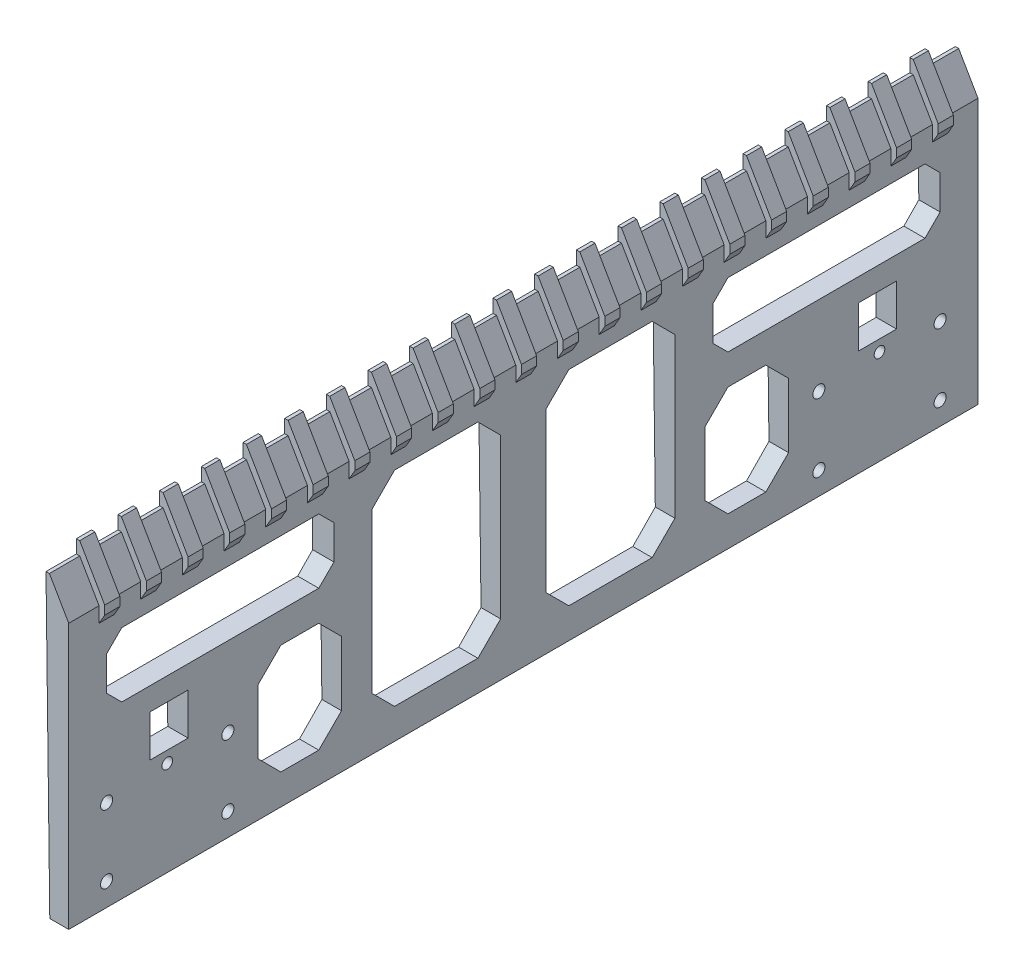
from build123d import *

# Parameters (mm, degrees)
SKETCH_1_W                  = 240
SKETCH_1_H                  = 70
EXTRUDE_1_DEPTH             = 6
CUT_EXTRUDE_2_DEPTH         = 251.071989635
EXTRUDE_2_DEPTH             = 240
EXTRUDE_3_DEPTH             = 2
PATTERN_LINEAR_1_COUNT      = 11
PATTERN_LINEAR_1_PITCH      = 11
PATTERN_LINEAR_1_COUNT_DIR2 = 11
PATTERN_LINEAR_1_PITCH_DIR2 = 11
HOLE_WIZARD_1_D             = 3.2
HOLE_WIZARD_1_CBORE_D       = 6
HOLE_WIZARD_1_CBORE_DEPTH   = 3.4
SKETCH_16_R                 = 1.4
CUT_EXTRUDE_3_DEPTH         = 10
SKETCH_17_W                 = 10
SKETCH_17_H                 = 11
CUT_EXTRUDE_4_DEPTH         = 251.112474699
CUT_EXTRUDE_5_REACH         = 252.112


with BuildPart() as part:
    # 草图1 → 凸台-拉伸1 (new body)
    with BuildSketch(Plane(origin=(0, 0, 0), x_dir=(0, 0, -1), z_dir=(1, 0, 0))):
        with Locations((120, -35)):
            Rectangle(SKETCH_1_W, SKETCH_1_H)
    extrude(amount=EXTRUDE_1_DEPTH)

    # 草图3 → 切除-拉伸2 (cut, through all)
    with BuildSketch(Plane(origin=(6, 0, 0), x_dir=(0, 0, -1), z_dir=(1, 0, 0))):
        Polygon((14, -8), (66, -8), (70, -12), (70, -21), (66, -25), (14, -25), (10, -21), (10, -12), align=None)
        Polygon((80, -14), (86, -8), (108, -8), (114, -14), (114, -56), (108, -62), (86, -62), (80, -56), align=None)
        Polygon((50, -56), (56, -62), (66, -62), (72, -56), (72, -39), (66, -33), (56, -33), (50, -39), align=None)
    cut_extrude_2 = extrude(amount=-CUT_EXTRUDE_2_DEPTH, mode=Mode.SUBTRACT)

    # 草图6 → 凸台-拉伸2 (add)
    with BuildSketch(Plane.XY):
        Polygon((6, 0), (0, 0), (0, 8.833459119), (0.9, 8.833459119), align=None)
    extrude(amount=-EXTRUDE_2_DEPTH)

    # 草图8 → 凸台-拉伸3 (add, symmetric)
    with BuildSketch(Plane.XY.offset(-120)):
        Polygon((0, 10.392304845), (0, 12.333459119), (0.9, 12.333459119), (7.5, 0.901923789), (7.5, -1.401923789), (6, -4), (6, 0), (0.9, 8.833459119), (0, 8.833459119), align=None)
    extrude_3 = extrude(amount=EXTRUDE_3_DEPTH, both=True)

    # 阵列(线性)1: Extrude 3 11 × 11
    with Locations(*[Vector(0, 0, 1) * (i * PATTERN_LINEAR_1_PITCH) + Vector(0, 0, -1) * (j * PATTERN_LINEAR_1_PITCH_DIR2) for i in range(PATTERN_LINEAR_1_COUNT) for j in range(PATTERN_LINEAR_1_COUNT_DIR2) if (i, j) != (0, 0)]):
        add(extrude_3)

    # 打孔尺寸(%根据)内六角圆柱头螺钉的类型1 (through all)
    with Locations(Plane.ZY):
        with Locations((-42, -46), (-10, -46), (-10, -64), (-42, -64)):
            hole_wizard_1 = CounterBoreHole(HOLE_WIZARD_1_D / 2, HOLE_WIZARD_1_CBORE_D / 2, HOLE_WIZARD_1_CBORE_DEPTH)

    # 草图16 → 切除-拉伸3 (cut)
    with BuildSketch(Plane.ZY):
        with Locations((-26, -45.023268437)):
            Circle(SKETCH_16_R)
    cut_extrude_3 = extrude(amount=-CUT_EXTRUDE_3_DEPTH, mode=Mode.SUBTRACT)

    # 镜向1: 打孔尺寸(%根据)内六角圆柱头螺钉的类型1 across plane
    add(hole_wizard_1.mirror(Plane.XY.offset(-120)), mode=Mode.SUBTRACT)

    # 镜向2: 切除-拉伸2, 切除-拉伸3 across plane
    add(cut_extrude_2.mirror(Plane.XY.offset(-120)), mode=Mode.SUBTRACT)
    add(cut_extrude_3.mirror(Plane.XY.offset(-120)), mode=Mode.SUBTRACT)

    # 草图17 → 切除-拉伸4 (cut, through all)
    with BuildSketch(Plane.ZY):
        with Locations((-26.5, -36.5)):
            Rectangle(SKETCH_17_W, SKETCH_17_H)
        with Locations((-213.5, -36.5)):
            Rectangle(SKETCH_17_W, SKETCH_17_H)
    extrude(amount=-CUT_EXTRUDE_4_DEPTH, mode=Mode.SUBTRACT)

    # 草图18 → 切除-拉伸5 (cut, up to next)
    with BuildSketch(Plane.XY, mode=Mode.PRIVATE) as cut_extrude_5_sk1:
        Polygon((0, -70), (1, -70), (0, 8.833459119), align=None)
    cut_extrude_5_tool1 = extrude(cut_extrude_5_sk1.sketch, amount=-CUT_EXTRUDE_5_REACH, mode=Mode.PRIVATE) & part.part
    add(cut_extrude_5_tool1.solids().sort_by_distance((0.333333, -43.72218, 0))[0], mode=Mode.SUBTRACT)


solid = part.part
